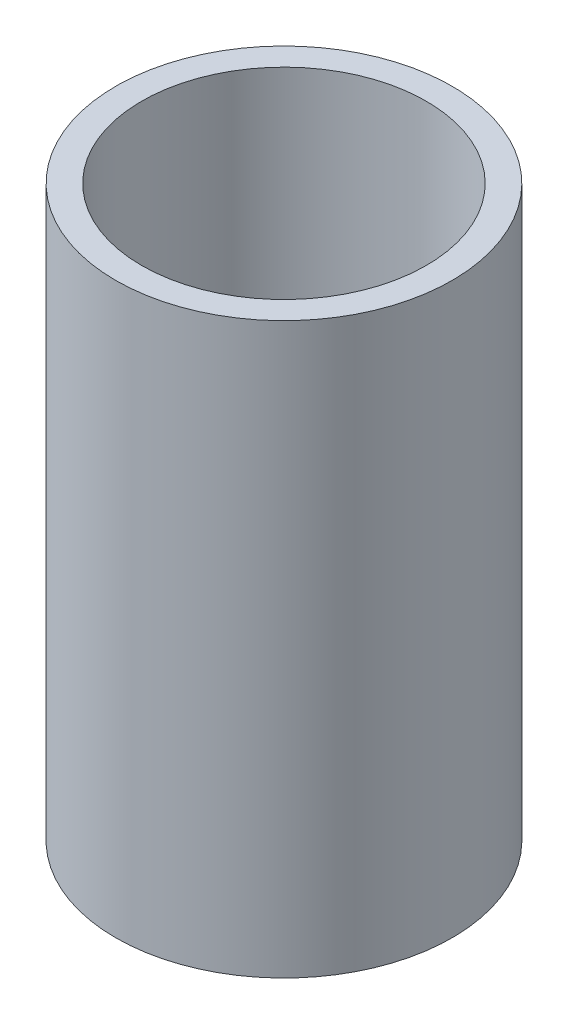
from build123d import *

# Parameters (mm, degrees)
SKETCH1_R           = 3.25
BOSS_EXTRUDE1_DEPTH = 11
SKETCH2_R           = 2.75
CUT_EXTRUDE2_DEPTH  = 11


with BuildPart() as part:
    # Sketch1 → Boss-Extrude1 (new body)
    with BuildSketch(Plane(origin=(0, 0, 0), x_dir=(1, 0, 0), z_dir=(0, 1, 0))):
        Circle(SKETCH1_R)
    extrude(amount=BOSS_EXTRUDE1_DEPTH)

    # Sketch2 → Cut-Extrude2 (cut)
    with BuildSketch(Plane(origin=(0, 11, 0), x_dir=(1, 0, 0), z_dir=(0, 1, 0))):
        Circle(SKETCH2_R)
    extrude(amount=-CUT_EXTRUDE2_DEPTH, mode=Mode.SUBTRACT)


solid = part.part
